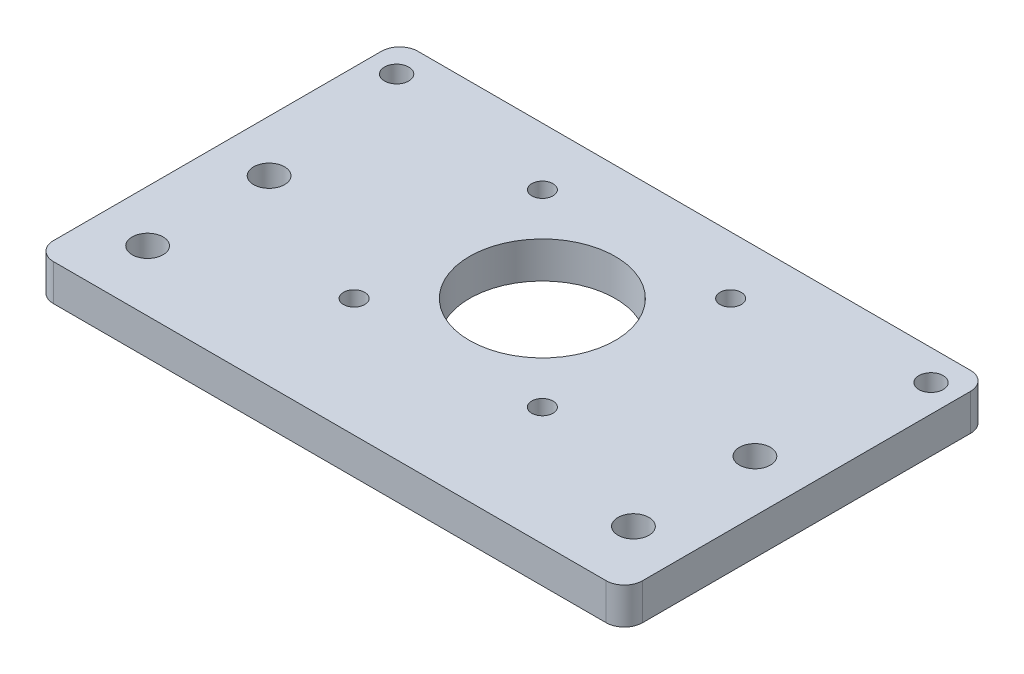
from build123d import *

# Parameters (mm, degrees)
SKETCH1_W             = 97
SKETCH1_H             = 60
BASE_DEPTH            = 6
SKETCH2_R             = 1.75
SKETCH2_R_2           = 12
STEPPERHOLES_DEPTH    = 58.343264644
FILLETEDGES3MM_R      = 3
SKETCH3_R             = 2.55
HOLESFORCORNERS_DEPTH = 58.343264644
SKETCH5_R             = 2
CABLETIEHOLES_DEPTH   = 58.343264644


with BuildPart() as part:
    # Sketch1 → Base (new body)
    with BuildSketch(Plane(origin=(0, 0, 0), x_dir=(1, 0, 0), z_dir=(0, 1, 0))):
        Rectangle(SKETCH1_W, SKETCH1_H)
    extrude(amount=BASE_DEPTH)

    # Sketch2 → StepperHoles (cut, through all)
    with BuildSketch(Plane(origin=(0, 6, 0), x_dir=(1, 0, 0), z_dir=(0, 1, 0))):
        with Locations((-15.5, 20.5)):
            Circle(SKETCH2_R)
        with Locations((15.5, 20.5)):
            Circle(SKETCH2_R)
        with Locations((0, 5)):
            Circle(SKETCH2_R_2)
        with Locations((-15.5, -10.5)):
            Circle(SKETCH2_R)
        with Locations((15.5, -10.5)):
            Circle(SKETCH2_R)
    extrude(amount=-STEPPERHOLES_DEPTH, mode=Mode.SUBTRACT)

    # FilletEdges3mm
    filletedges3mm_edges = [part.edges().sort_by_distance(p)[0] for p in [
        (48.5, 3, 30),
        (48.5, 3, -30),
        (-48.5, 3, -30),
        (-48.5, 3, 30),
    ]]
    fillet(filletedges3mm_edges, radius=FILLETEDGES3MM_R)

    # Sketch3 → HolesForCorners (cut, through all)
    with BuildSketch(Plane.XZ):
        with Locations((-40, 20)):
            Circle(SKETCH3_R)
        with Locations((-40, 0)):
            Circle(SKETCH3_R)
        with Locations((40, 20)):
            Circle(SKETCH3_R)
        with Locations((40, 0)):
            Circle(SKETCH3_R)
    extrude(amount=-HOLESFORCORNERS_DEPTH, mode=Mode.SUBTRACT)

    # Sketch5 → CableTieHoles (cut, through all)
    with BuildSketch(Plane.XZ):
        with Locations((-44, -25)):
            Circle(SKETCH5_R)
        with Locations((44, -25)):
            Circle(SKETCH5_R)
    extrude(amount=-CABLETIEHOLES_DEPTH, mode=Mode.SUBTRACT)


solid = part.part
